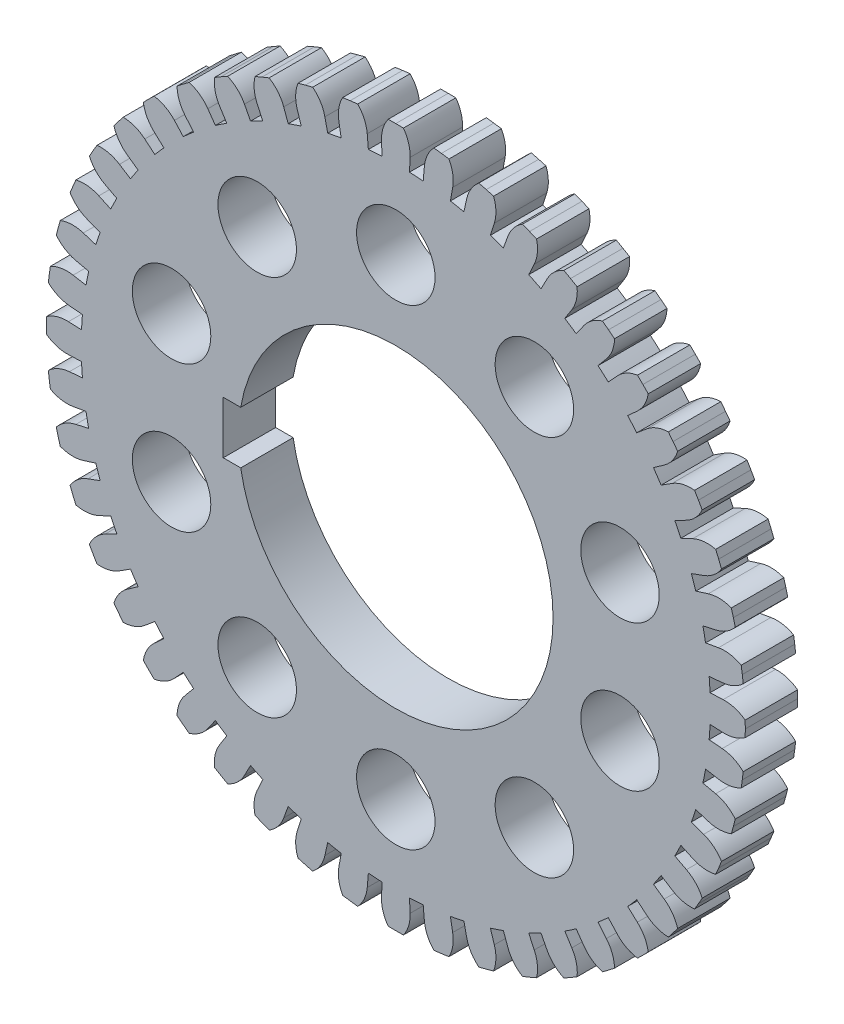
from build123d import *

# Parameters (mm, degrees)
BOSS_EXTRU_3_DEPTH           = 3
R_P_TITION_CIRCULAIRE1_COUNT = 48
ESQUISSE2_R                  = 9
ESQUISSE2_R_2                = 2.245716997
ENL_V_MAT_EXTRU_1_DEPTH      = 3
ENL_V_START                  = -3
ENL_V_MAT_EXTRU_2_DEPTH      = 3


with BuildPart() as part:
    # Esquisse1 → Boss.-Extru.3 (new body)
    with BuildSketch(Plane.XY):
        with BuildLine():
            Line((17.982867988, 0.785148973), (18.732154155, 0.817863513))
            ThreePointArc((18.732154155, 0.817863513), (19.396152631, 0.734516401), (19.995240542, 0.436297701))
            Line((19.995240542, 0.436297701), (20, 0))
            Line((20, 0), (19.995240542, -0.436297701))
            ThreePointArc((19.995240542, -0.436297701), (19.396152631, -0.734516401), (18.732154155, -0.817863513))
            Line((18.732154155, -0.817863513), (17.982867988, -0.785148973))
            ThreePointArc((17.982867988, -0.785148973), (17.961460618, -1.177256326), (17.931504566, -1.568803369))
            Line((17.931504566, -1.568803369), (0, 0))
            Line((0, 0), (17.931504566, 1.568803369))
            ThreePointArc((17.931504566, 1.568803369), (17.961460618, 1.177256326), (17.982867988, 0.785148973))
        make_face()
    boss_extru_3 = extrude(amount=BOSS_EXTRU_3_DEPTH)

    # Répétition circulaire1: Boss.-Extru.3 ×48 about axis
    r_p_tition_circulaire1_axis = Axis((0, 0, 0), (0, 0, 1))
    for i in range(1, R_P_TITION_CIRCULAIRE1_COUNT):
        add(boss_extru_3.rotate(r_p_tition_circulaire1_axis, i * 360 / R_P_TITION_CIRCULAIRE1_COUNT))

    # Esquisse2 → Enlèv. mat.-Extru.1 (cut)
    with BuildSketch(Plane(origin=(0, 0, 0), x_dir=(-1, 0, 0), z_dir=(0, 0, -1))):
        Circle(ESQUISSE2_R)
        with Locations((0, 13.491433994)):
            Circle(ESQUISSE2_R_2)
        with Locations((7.930065934, 10.91479938)):
            Circle(ESQUISSE2_R_2)
        with Locations((12.831116214, 4.169082383)):
            Circle(ESQUISSE2_R_2)
        with Locations((12.831116214, -4.169082383)):
            Circle(ESQUISSE2_R_2)
        with Locations((7.930065934, -10.91479938)):
            Circle(ESQUISSE2_R_2)
        with Locations((0, -13.491433994)):
            Circle(ESQUISSE2_R_2)
        with Locations((-7.930065934, -10.91479938)):
            Circle(ESQUISSE2_R_2)
        with Locations((-12.831116214, -4.169082383)):
            Circle(ESQUISSE2_R_2)
        with Locations((-12.831116214, 4.169082383)):
            Circle(ESQUISSE2_R_2)
        with Locations((-7.930065934, 10.91479938)):
            Circle(ESQUISSE2_R_2)
    extrude(amount=-ENL_V_MAT_EXTRU_1_DEPTH, mode=Mode.SUBTRACT)

    # Esquisse3 → Enlèv. mat.-Extru.2 (cut)
    with BuildSketch(Plane.XY.offset(3).offset(ENL_V_START)):
        with BuildLine():
            Line((-9.874119675, -1.5), (-8.874119675, -1.5))
            ThreePointArc((-8.874119675, -1.5), (-9, 0), (-8.874119675, 1.5))
            Line((-8.874119675, 1.5), (-9.874119675, 1.5))
            Line((-9.874119675, 1.5), (-9.874119675, -1.5))
        make_face()
    extrude(amount=ENL_V_MAT_EXTRU_2_DEPTH, mode=Mode.SUBTRACT)


solid = part.part
